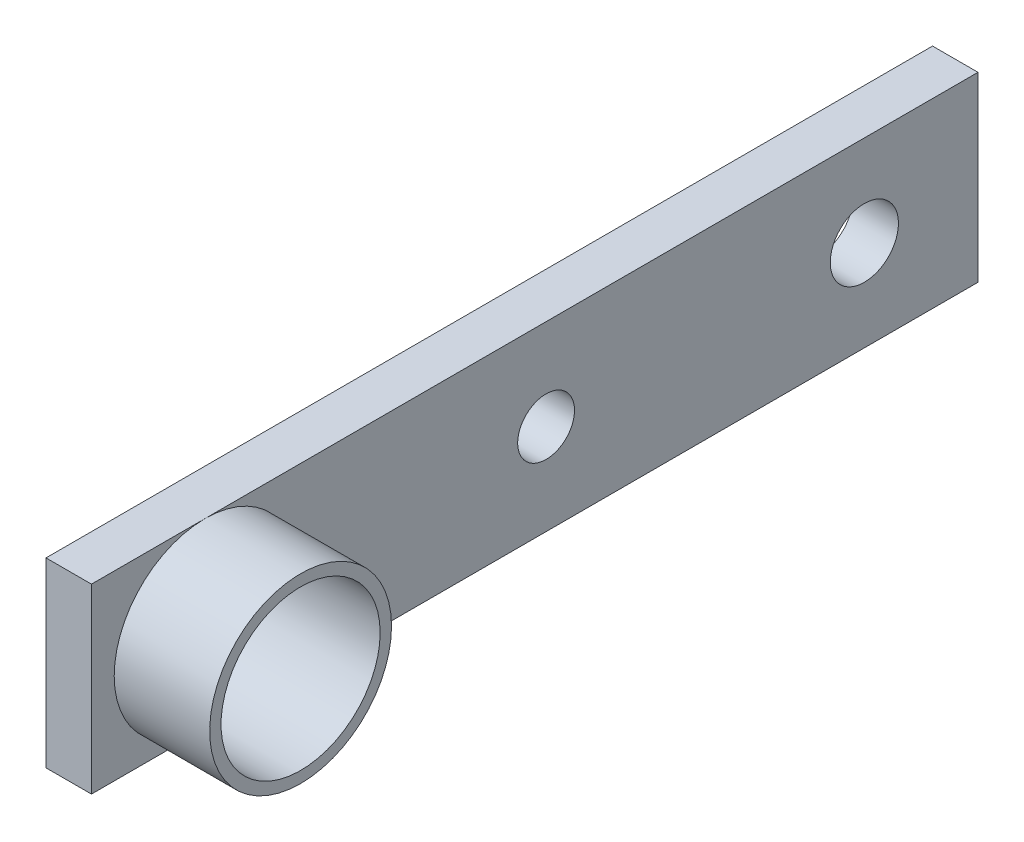
from build123d import *

# Parameters (mm, degrees)
SKETCH1_W           = 123.825
SKETCH1_H           = 25.4
SKETCH1_R           = 11.1125
SKETCH1_R_2         = 3.96875
SKETCH1_R_3         = 4.7625
BOSS_EXTRUDE1_DEPTH = 6.35
SKETCH3_R           = 12.7
SKETCH3_R_2         = 11.1125
BOSS_EXTRUDE2_DEPTH = 13.335


with BuildPart() as part:
    # Sketch1 → Boss-Extrude1 (new body)
    with BuildSketch(Plane(origin=(0, 0, 0), x_dir=(0, 0, -1), z_dir=(1, 0, 0))):
        with Locations((61.9125, 12.7)):
            Rectangle(SKETCH1_W, SKETCH1_H)
        with Locations((15.875, 12.7)):
            Circle(SKETCH1_R, mode=Mode.SUBTRACT)
        with Locations((63.5, 12.7)):
            Circle(SKETCH1_R_2, mode=Mode.SUBTRACT)
        with Locations((107.95, 12.7)):
            Circle(SKETCH1_R_3, mode=Mode.SUBTRACT)
    extrude(amount=BOSS_EXTRUDE1_DEPTH)

    # Sketch3 → Boss-Extrude2 (add)
    with BuildSketch(Plane(origin=(6.35, 0, 0), x_dir=(0, 0, -1), z_dir=(1, 0, 0))):
        with Locations((15.875, 12.7)):
            Circle(SKETCH3_R)
        with Locations((15.875, 12.7)):
            Circle(SKETCH3_R_2, mode=Mode.SUBTRACT)
    extrude(amount=BOSS_EXTRUDE2_DEPTH)


solid = part.part
